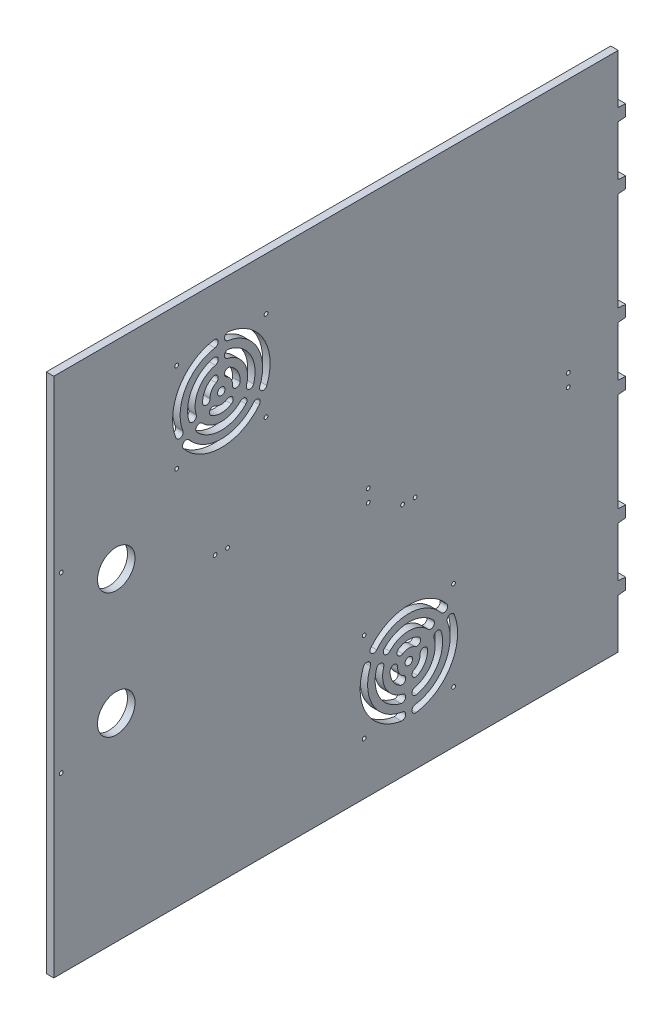
from build123d import *
from OCP.BRepFilletAPI import BRepFilletAPI_MakeChamfer

# Parameters (mm, degrees)
BOSS_EXTRUDE1_DEPTH      = 6
SKETCH4_W                = 6
SKETCH4_H                = 10
BOSS_EXTRUDE2_DEPTH      = 6
CUT_EXTRUDE3_DEPTH       = 312.784173588
SKETCH10_W               = 10
SKETCH10_H               = 6
BOSS_EXTRUDE4_DEPTH      = 6
FILLET2_R                = 10
MIRROR1_COPY_1_DEPTH     = 312.784173588
MIRROR1_COPY_2_SKETCH_W  = 10
MIRROR1_COPY_2_SKETCH_H  = 6
MIRROR1_COPY_2_DEPTH     = 6
FILLET2_OF_MIRROR1_R     = 10
CHAMFER1_SIZE            = 6
CHAMFER1_SIZE_2          = 0.5
CHAMFER2_SIZE            = 0.5
CHAMFER2_SIZE_2          = 6
SKETCH13_R               = 1.5
CUT_EXTRUDE4_DEPTH       = 316.827121856
DELETEFACE1_START        = -1
DELETEFACE1_DEPTH        = 8
SKETCH12_W               = 451.56
SKETCH12_H               = 416.9
SKETCH12_R               = 1.5
BOSS_EXTRUDE6_DEPTH      = 6
SKETCH14_R               = 15
CUT_EXTRUDE5_DEPTH       = 312.784173588
SKETCH15_R               = 1.5
SKETCH15_R_2             = 3
CUT_EXTRUDE6_DEPTH       = 312.784173588
CIRPATTERN2_START        = -1
CIRPATTERN2_DEPTH        = 8
SKETCH16_R               = 1.5
CUT_EXTRUDE7_DEPTH       = 312.784173588
MOVE_FACE1_OUTLINE_R     = 1.5
MOVE_FACE1_OUTLINE_R_2   = 3
MOVE_FACE1_DEPTH         = 6
MOVE_FACE1_2_OUTLINE_R   = 1.5
MOVE_FACE1_2_OUTLINE_R_2 = 3
MOVE_FACE1_2_DEPTH       = 6


with BuildPart() as part:
    # Sketch1 → Boss-Extrude1 (new body)
    with BuildSketch(Plane(origin=(0, 0, 0), x_dir=(0, 0, -1), z_dir=(1, 0, 0))):
        Polygon((0, 208.45), (-225.78, 208.45), (-225.78, 140.466666667), (-219.78, 140.466666667), (-219.78, 141.866666667), (-217.58, 141.866666667), (-217.58, 140.466666667), (-214.78, 140.466666667), (-214.78, 137.466666667), (-217.58, 137.466666667), (-217.58, 136.066666667), (-219.78, 136.066666667), (-219.78, 137.466666667), (-225.78, 137.466666667), (-225.78, 1.5), (-219.78, 1.5), (-219.78, 2.9), (-217.58, 2.9), (-217.58, 1.5), (-214.78, 1.5), (-214.78, -1.5), (-217.58, -1.5), (-217.58, -2.9), (-219.78, -2.9), (-219.78, -1.5), (-225.78, -1.5), (-225.78, -137.466666667), (-219.78, -137.466666667), (-219.78, -136.066666667), (-217.58, -136.066666667), (-217.58, -137.466666667), (-214.78, -137.466666667), (-214.78, -140.466666667), (-217.58, -140.466666667), (-217.58, -141.866666667), (-219.78, -141.866666667), (-219.78, -140.466666667), (-225.78, -140.466666667), (-225.78, -208.45), (0, -208.45), align=None)
    boss_extrude1 = extrude(amount=BOSS_EXTRUDE1_DEPTH)

    # Sketch4 → Boss-Extrude2 (add)
    with BuildSketch(Plane(origin=(6, 0, 0), x_dir=(0, 0, -1), z_dir=(1, 0, 0))):
        with Locations((-228.78, 163.966666667)):
            Rectangle(SKETCH4_W, SKETCH4_H)
        with Locations((-228.78, 113.966666667)):
            Rectangle(SKETCH4_W, SKETCH4_H)
        with Locations((-228.78, 25)):
            Rectangle(SKETCH4_W, SKETCH4_H)
        with Locations((-228.78, -25)):
            Rectangle(SKETCH4_W, SKETCH4_H)
        with Locations((-228.78, -113.966666667)):
            Rectangle(SKETCH4_W, SKETCH4_H)
        with Locations((-228.78, -163.966666667)):
            Rectangle(SKETCH4_W, SKETCH4_H)
    boss_extrude2 = extrude(amount=-BOSS_EXTRUDE2_DEPTH)

    # Sketch9 → Cut-Extrude3 (cut, through all)
    with BuildSketch(Plane(origin=(6, 0, 0), x_dir=(0, 0, -1), z_dir=(1, 0, 0))):
        Polygon((-152.02, 208.45), (-152.02, 202.45), (-153.42, 202.45), (-153.42, 200.25), (-152.02, 200.25), (-152.02, 197.45), (-149.02, 197.45), (-149.02, 200.25), (-147.62, 200.25), (-147.62, 202.45), (-149.02, 202.45), (-149.02, 208.45), align=None)
        Polygon((-1.5, 208.45), (-1.5, 202.45), (-2.9, 202.45), (-2.9, 200.25), (-1.5, 200.25), (-1.5, 197.45), (1.5, 197.45), (1.5, 200.25), (2.9, 200.25), (2.9, 202.45), (1.5, 202.45), (1.5, 208.45), align=None)
    cut_extrude3 = extrude(amount=-CUT_EXTRUDE3_DEPTH, mode=Mode.SUBTRACT)

    # Sketch10 → Boss-Extrude4 (add)
    with BuildSketch(Plane(origin=(6, 0, 0), x_dir=(0, 0, -1), z_dir=(1, 0, 0))):
        with Locations((-175.52, 211.45)):
            Rectangle(SKETCH10_W, SKETCH10_H)
        with Locations((-125.52, 211.45)):
            Rectangle(SKETCH10_W, SKETCH10_H)
        with Locations((-25, 211.45)):
            Rectangle(SKETCH10_W, SKETCH10_H)
    boss_extrude4 = extrude(amount=-BOSS_EXTRUDE4_DEPTH)

    # Mirror2: Cut-Extrude3, Boss-Extrude4 across plane
    add(cut_extrude3.mirror(Plane.ZX), mode=Mode.SUBTRACT)
    add(boss_extrude4.mirror(Plane.ZX))

    # Fillet2
    fillet2_edges = [part.edges().sort_by_distance(p)[0] for p in [
        (3, 208.45, 225.78),
        (3, -208.45, 225.78),
    ]]
    fillet(fillet2_edges, radius=FILLET2_R)

    # Mirror1: Boss-Extrude1, Boss-Extrude2, Cut-Extrude3, Boss-Extrude4 across plane
    add(boss_extrude1.mirror(Plane(origin=(6, -208.45, 0), x_dir=(1, 0, 0), z_dir=(0, 0, 1))))
    add(boss_extrude2.mirror(Plane(origin=(6, -208.45, 0), x_dir=(1, 0, 0), z_dir=(0, 0, 1))))
    add(cut_extrude3.mirror(Plane(origin=(6, -208.45, 0), x_dir=(1, 0, 0), z_dir=(0, 0, 1))), mode=Mode.SUBTRACT)
    add(boss_extrude4.mirror(Plane(origin=(6, -208.45, 0), x_dir=(1, 0, 0), z_dir=(0, 0, 1))))

    # Mirror1 copy 1 sketch → Mirror1 copy 1 (cut, through all)
    with BuildSketch(Plane(origin=(6, 0, 0), x_dir=(0, 0, 1), z_dir=(1, 0, 0))):
        Polygon((-152.02, 208.45), (-152.02, 202.45), (-153.42, 202.45), (-153.42, 200.25), (-152.02, 200.25), (-152.02, 197.45), (-149.02, 197.45), (-149.02, 200.25), (-147.62, 200.25), (-147.62, 202.45), (-149.02, 202.45), (-149.02, 208.45), align=None)
        Polygon((-1.5, 208.45), (-1.5, 202.45), (-2.9, 202.45), (-2.9, 200.25), (-1.5, 200.25), (-1.5, 197.45), (1.5, 197.45), (1.5, 200.25), (2.9, 200.25), (2.9, 202.45), (1.5, 202.45), (1.5, 208.45), align=None)
    extrude(amount=-MIRROR1_COPY_1_DEPTH, mode=Mode.SUBTRACT)

    # Mirror1 copy 2 sketch → Mirror1 copy 2 (add)
    with BuildSketch(Plane(origin=(6, 0, 0), x_dir=(0, 0, 1), z_dir=(1, 0, 0))):
        with Locations((-175.52, 211.45)):
            Rectangle(MIRROR1_COPY_2_SKETCH_W, MIRROR1_COPY_2_SKETCH_H)
        with Locations((-125.52, 211.45)):
            Rectangle(MIRROR1_COPY_2_SKETCH_W, MIRROR1_COPY_2_SKETCH_H)
        with Locations((-25, 211.45)):
            Rectangle(MIRROR1_COPY_2_SKETCH_W, MIRROR1_COPY_2_SKETCH_H)
    extrude(amount=-MIRROR1_COPY_2_DEPTH)

    # Fillet2 of Mirror1
    fillet2_of_mirror1_edges = [part.edges().sort_by_distance(p)[0] for p in [
        (3, 208.45, -225.78),
        (3, -208.45, -225.78),
    ]]
    fillet(fillet2_of_mirror1_edges, radius=FILLET2_OF_MIRROR1_R)

    # Chamfer1
    chamfer1_edges_1 = [part.edges().sort_by_distance(p)[0] for p in [
        (3, 168.966666667, 231.78),
    ]]
    chamfer1_side_1 = [part.faces().sort_by_distance(p)[0] for p in [
        (3, 168.966666667, 231.77),
    ]]
    chamfer1_edges_2 = [part.edges().sort_by_distance(p)[0] for p in [
        (3, -158.966666667, 231.78),
    ]]
    chamfer1_side_2 = [part.faces().sort_by_distance(p)[0] for p in [
        (3, -158.966666667, 231.77),
    ]]
    chamfer1_edges_3 = [part.edges().sort_by_distance(p)[0] for p in [
        (3, -108.966666667, 231.78),
    ]]
    chamfer1_side_3 = [part.faces().sort_by_distance(p)[0] for p in [
        (3, -108.966666667, 231.77),
    ]]
    chamfer1_edges_4 = [part.edges().sort_by_distance(p)[0] for p in [
        (3, -20, 231.78),
    ]]
    chamfer1_side_4 = [part.faces().sort_by_distance(p)[0] for p in [
        (3, -20, 231.77),
    ]]
    chamfer1_edges_5 = [part.edges().sort_by_distance(p)[0] for p in [
        (3, 30, 231.78),
    ]]
    chamfer1_side_5 = [part.faces().sort_by_distance(p)[0] for p in [
        (3, 30, 231.77),
    ]]
    chamfer1_edges_6 = [part.edges().sort_by_distance(p)[0] for p in [
        (3, 118.966666667, 231.78),
    ]]
    chamfer1_side_6 = [part.faces().sort_by_distance(p)[0] for p in [
        (3, 118.966666667, 231.77),
    ]]
    chamfer1_edges_7 = [part.edges().sort_by_distance(p)[0] for p in [
        (3, -168.966666667, -231.78),
    ]]
    chamfer1_side_7 = [part.faces().sort_by_distance(p)[0] for p in [
        (3, -168.956666667, -231.78),
    ]]
    chamfer1_edges_8 = [part.edges().sort_by_distance(p)[0] for p in [
        (3, -118.966666667, -231.78),
    ]]
    chamfer1_side_8 = [part.faces().sort_by_distance(p)[0] for p in [
        (3, -118.956666667, -231.78),
    ]]
    chamfer1_edges_9 = [part.edges().sort_by_distance(p)[0] for p in [
        (3, -30, -231.78),
    ]]
    chamfer1_side_9 = [part.faces().sort_by_distance(p)[0] for p in [
        (3, -29.99, -231.78),
    ]]
    chamfer1_edges_10 = [part.edges().sort_by_distance(p)[0] for p in [
        (3, 20, -231.78),
    ]]
    chamfer1_side_10 = [part.faces().sort_by_distance(p)[0] for p in [
        (3, 20.01, -231.78),
    ]]
    chamfer1_edges_11 = [part.edges().sort_by_distance(p)[0] for p in [
        (3, 158.966666667, -231.78),
    ]]
    chamfer1_side_11 = [part.faces().sort_by_distance(p)[0] for p in [
        (3, 158.976666667, -231.78),
    ]]
    chamfer1_edges_12 = [part.edges().sort_by_distance(p)[0] for p in [
        (3, 108.966666667, -231.78),
    ]]
    chamfer1_side_12 = [part.faces().sort_by_distance(p)[0] for p in [
        (3, 108.976666667, -231.78),
    ]]
    chamfer1_edges_13 = [part.edges().sort_by_distance(p)[0] for p in [
        (3, -214.45, 180.52),
    ]]
    chamfer1_side_13 = [part.faces().sort_by_distance(p)[0] for p in [
        (3, -214.45, 180.51),
    ]]
    chamfer1_edges_14 = [part.edges().sort_by_distance(p)[0] for p in [
        (3, -214.45, 130.52),
    ]]
    chamfer1_side_14 = [part.faces().sort_by_distance(p)[0] for p in [
        (3, -214.45, 130.51),
    ]]
    chamfer1_edges_15 = [part.edges().sort_by_distance(p)[0] for p in [
        (3, -214.45, 30),
    ]]
    chamfer1_side_15 = [part.faces().sort_by_distance(p)[0] for p in [
        (3, -214.45, 29.99),
    ]]
    chamfer1_edges_16 = [part.edges().sort_by_distance(p)[0] for p in [
        (3, -214.45, -20),
    ]]
    chamfer1_side_16 = [part.faces().sort_by_distance(p)[0] for p in [
        (3, -214.45, -20.01),
    ]]
    chamfer1_edges_17 = [part.edges().sort_by_distance(p)[0] for p in [
        (3, -214.45, -120.52),
    ]]
    chamfer1_side_17 = [part.faces().sort_by_distance(p)[0] for p in [
        (3, -214.45, -120.53),
    ]]
    chamfer1_edges_18 = [part.edges().sort_by_distance(p)[0] for p in [
        (3, -214.45, -170.52),
    ]]
    chamfer1_side_18 = [part.faces().sort_by_distance(p)[0] for p in [
        (3, -214.45, -170.53),
    ]]
    chamfer1_edges_19 = [part.edges().sort_by_distance(p)[0] for p in [
        (3, 214.45, -180.52),
    ]]
    chamfer1_side_19 = [part.faces().sort_by_distance(p)[0] for p in [
        (3, 214.44, -180.52),
    ]]
    chamfer1_edges_20 = [part.edges().sort_by_distance(p)[0] for p in [
        (3, 214.45, -130.52),
    ]]
    chamfer1_side_20 = [part.faces().sort_by_distance(p)[0] for p in [
        (3, 214.44, -130.52),
    ]]
    chamfer1_edges_21 = [part.edges().sort_by_distance(p)[0] for p in [
        (3, 214.45, -30),
    ]]
    chamfer1_side_21 = [part.faces().sort_by_distance(p)[0] for p in [
        (3, 214.44, -30),
    ]]
    chamfer1_edges_22 = [part.edges().sort_by_distance(p)[0] for p in [
        (3, 214.45, 20),
    ]]
    chamfer1_side_22 = [part.faces().sort_by_distance(p)[0] for p in [
        (3, 214.44, 20),
    ]]
    chamfer1_edges_23 = [part.edges().sort_by_distance(p)[0] for p in [
        (3, 214.45, 120.52),
    ]]
    chamfer1_side_23 = [part.faces().sort_by_distance(p)[0] for p in [
        (3, 214.44, 120.52),
    ]]
    chamfer1_edges_24 = [part.edges().sort_by_distance(p)[0] for p in [
        (3, 214.45, 170.52),
    ]]
    chamfer1_side_24 = [part.faces().sort_by_distance(p)[0] for p in [
        (3, 214.44, 170.52),
    ]]
    chamfer1 = BRepFilletAPI_MakeChamfer(part.part.solid().wrapped)
    for e in chamfer1_edges_1:
        chamfer1.Add(CHAMFER1_SIZE - 0.0001, CHAMFER1_SIZE_2 - 0.0001, e.wrapped, chamfer1_side_1[0].wrapped)
    for e in chamfer1_edges_2:
        chamfer1.Add(CHAMFER1_SIZE - 0.0001, CHAMFER1_SIZE_2 - 0.0001, e.wrapped, chamfer1_side_2[0].wrapped)
    for e in chamfer1_edges_3:
        chamfer1.Add(CHAMFER1_SIZE - 0.0001, CHAMFER1_SIZE_2 - 0.0001, e.wrapped, chamfer1_side_3[0].wrapped)
    for e in chamfer1_edges_4:
        chamfer1.Add(CHAMFER1_SIZE - 0.0001, CHAMFER1_SIZE_2 - 0.0001, e.wrapped, chamfer1_side_4[0].wrapped)
    for e in chamfer1_edges_5:
        chamfer1.Add(CHAMFER1_SIZE - 0.0001, CHAMFER1_SIZE_2 - 0.0001, e.wrapped, chamfer1_side_5[0].wrapped)
    for e in chamfer1_edges_6:
        chamfer1.Add(CHAMFER1_SIZE - 0.0001, CHAMFER1_SIZE_2 - 0.0001, e.wrapped, chamfer1_side_6[0].wrapped)
    for e in chamfer1_edges_7:
        chamfer1.Add(CHAMFER1_SIZE_2 - 0.0001, CHAMFER1_SIZE - 0.0001, e.wrapped, chamfer1_side_7[0].wrapped)
    for e in chamfer1_edges_8:
        chamfer1.Add(CHAMFER1_SIZE_2 - 0.0001, CHAMFER1_SIZE - 0.0001, e.wrapped, chamfer1_side_8[0].wrapped)
    for e in chamfer1_edges_9:
        chamfer1.Add(CHAMFER1_SIZE_2 - 0.0001, CHAMFER1_SIZE - 0.0001, e.wrapped, chamfer1_side_9[0].wrapped)
    for e in chamfer1_edges_10:
        chamfer1.Add(CHAMFER1_SIZE_2 - 0.0001, CHAMFER1_SIZE - 0.0001, e.wrapped, chamfer1_side_10[0].wrapped)
    for e in chamfer1_edges_11:
        chamfer1.Add(CHAMFER1_SIZE_2 - 0.0001, CHAMFER1_SIZE - 0.0001, e.wrapped, chamfer1_side_11[0].wrapped)
    for e in chamfer1_edges_12:
        chamfer1.Add(CHAMFER1_SIZE_2 - 0.0001, CHAMFER1_SIZE - 0.0001, e.wrapped, chamfer1_side_12[0].wrapped)
    for e in chamfer1_edges_13:
        chamfer1.Add(CHAMFER1_SIZE_2 - 0.0001, CHAMFER1_SIZE - 0.0001, e.wrapped, chamfer1_side_13[0].wrapped)
    for e in chamfer1_edges_14:
        chamfer1.Add(CHAMFER1_SIZE_2 - 0.0001, CHAMFER1_SIZE - 0.0001, e.wrapped, chamfer1_side_14[0].wrapped)
    for e in chamfer1_edges_15:
        chamfer1.Add(CHAMFER1_SIZE_2 - 0.0001, CHAMFER1_SIZE - 0.0001, e.wrapped, chamfer1_side_15[0].wrapped)
    for e in chamfer1_edges_16:
        chamfer1.Add(CHAMFER1_SIZE_2 - 0.0001, CHAMFER1_SIZE - 0.0001, e.wrapped, chamfer1_side_16[0].wrapped)
    for e in chamfer1_edges_17:
        chamfer1.Add(CHAMFER1_SIZE_2 - 0.0001, CHAMFER1_SIZE - 0.0001, e.wrapped, chamfer1_side_17[0].wrapped)
    for e in chamfer1_edges_18:
        chamfer1.Add(CHAMFER1_SIZE_2 - 0.0001, CHAMFER1_SIZE - 0.0001, e.wrapped, chamfer1_side_18[0].wrapped)
    for e in chamfer1_edges_19:
        chamfer1.Add(CHAMFER1_SIZE - 0.0001, CHAMFER1_SIZE_2 - 0.0001, e.wrapped, chamfer1_side_19[0].wrapped)
    for e in chamfer1_edges_20:
        chamfer1.Add(CHAMFER1_SIZE - 0.0001, CHAMFER1_SIZE_2 - 0.0001, e.wrapped, chamfer1_side_20[0].wrapped)
    for e in chamfer1_edges_21:
        chamfer1.Add(CHAMFER1_SIZE - 0.0001, CHAMFER1_SIZE_2 - 0.0001, e.wrapped, chamfer1_side_21[0].wrapped)
    for e in chamfer1_edges_22:
        chamfer1.Add(CHAMFER1_SIZE - 0.0001, CHAMFER1_SIZE_2 - 0.0001, e.wrapped, chamfer1_side_22[0].wrapped)
    for e in chamfer1_edges_23:
        chamfer1.Add(CHAMFER1_SIZE - 0.0001, CHAMFER1_SIZE_2 - 0.0001, e.wrapped, chamfer1_side_23[0].wrapped)
    for e in chamfer1_edges_24:
        chamfer1.Add(CHAMFER1_SIZE - 0.0001, CHAMFER1_SIZE_2 - 0.0001, e.wrapped, chamfer1_side_24[0].wrapped)
    add(Compound.cast(chamfer1.Shape()), mode=Mode.REPLACE)  # a hair under: the kernel refuses the full size

    # Chamfer2
    chamfer2_edges_1 = [part.edges().sort_by_distance(p)[0] for p in [
        (3, 158.966666667, 231.78),
    ]]
    chamfer2_side_1 = [part.faces().sort_by_distance(p)[0] for p in [
        (3, 158.976666667, 231.78),
    ]]
    chamfer2_edges_2 = [part.edges().sort_by_distance(p)[0] for p in [
        (3, -118.966666667, 231.78),
    ]]
    chamfer2_side_2 = [part.faces().sort_by_distance(p)[0] for p in [
        (3, -118.956666667, 231.78),
    ]]
    chamfer2_edges_3 = [part.edges().sort_by_distance(p)[0] for p in [
        (3, -168.966666667, 231.78),
    ]]
    chamfer2_side_3 = [part.faces().sort_by_distance(p)[0] for p in [
        (3, -168.956666667, 231.78),
    ]]
    chamfer2_edges_4 = [part.edges().sort_by_distance(p)[0] for p in [
        (3, 20, 231.78),
    ]]
    chamfer2_side_4 = [part.faces().sort_by_distance(p)[0] for p in [
        (3, 20.01, 231.78),
    ]]
    chamfer2_edges_5 = [part.edges().sort_by_distance(p)[0] for p in [
        (3, -30, 231.78),
    ]]
    chamfer2_side_5 = [part.faces().sort_by_distance(p)[0] for p in [
        (3, -29.99, 231.78),
    ]]
    chamfer2_edges_6 = [part.edges().sort_by_distance(p)[0] for p in [
        (3, 108.966666667, 231.78),
    ]]
    chamfer2_side_6 = [part.faces().sort_by_distance(p)[0] for p in [
        (3, 108.976666667, 231.78),
    ]]
    chamfer2_edges_7 = [part.edges().sort_by_distance(p)[0] for p in [
        (3, 118.966666667, -231.78),
    ]]
    chamfer2_side_7 = [part.faces().sort_by_distance(p)[0] for p in [
        (3, 118.966666667, -231.77),
    ]]
    chamfer2_edges_8 = [part.edges().sort_by_distance(p)[0] for p in [
        (3, 168.966666667, -231.78),
    ]]
    chamfer2_side_8 = [part.faces().sort_by_distance(p)[0] for p in [
        (3, 168.966666667, -231.77),
    ]]
    chamfer2_edges_9 = [part.edges().sort_by_distance(p)[0] for p in [
        (3, -20, -231.78),
    ]]
    chamfer2_side_9 = [part.faces().sort_by_distance(p)[0] for p in [
        (3, -20, -231.77),
    ]]
    chamfer2_edges_10 = [part.edges().sort_by_distance(p)[0] for p in [
        (3, 30, -231.78),
    ]]
    chamfer2_side_10 = [part.faces().sort_by_distance(p)[0] for p in [
        (3, 30, -231.77),
    ]]
    chamfer2_edges_11 = [part.edges().sort_by_distance(p)[0] for p in [
        (3, -108.966666667, -231.78),
    ]]
    chamfer2_side_11 = [part.faces().sort_by_distance(p)[0] for p in [
        (3, -108.966666667, -231.77),
    ]]
    chamfer2_edges_12 = [part.edges().sort_by_distance(p)[0] for p in [
        (3, -158.966666667, -231.78),
    ]]
    chamfer2_side_12 = [part.faces().sort_by_distance(p)[0] for p in [
        (3, -158.966666667, -231.77),
    ]]
    chamfer2_edges_13 = [part.edges().sort_by_distance(p)[0] for p in [
        (3, 214.45, 180.52),
    ]]
    chamfer2_side_13 = [part.faces().sort_by_distance(p)[0] for p in [
        (3, 214.45, 180.51),
    ]]
    chamfer2_edges_14 = [part.edges().sort_by_distance(p)[0] for p in [
        (3, 214.45, 130.52),
    ]]
    chamfer2_side_14 = [part.faces().sort_by_distance(p)[0] for p in [
        (3, 214.45, 130.51),
    ]]
    chamfer2_edges_15 = [part.edges().sort_by_distance(p)[0] for p in [
        (3, 214.45, 30),
    ]]
    chamfer2_side_15 = [part.faces().sort_by_distance(p)[0] for p in [
        (3, 214.45, 29.99),
    ]]
    chamfer2_edges_16 = [part.edges().sort_by_distance(p)[0] for p in [
        (3, 214.45, -20),
    ]]
    chamfer2_side_16 = [part.faces().sort_by_distance(p)[0] for p in [
        (3, 214.45, -20.01),
    ]]
    chamfer2_edges_17 = [part.edges().sort_by_distance(p)[0] for p in [
        (3, 214.45, -120.52),
    ]]
    chamfer2_side_17 = [part.faces().sort_by_distance(p)[0] for p in [
        (3, 214.45, -120.53),
    ]]
    chamfer2_edges_18 = [part.edges().sort_by_distance(p)[0] for p in [
        (3, 214.45, -170.52),
    ]]
    chamfer2_side_18 = [part.faces().sort_by_distance(p)[0] for p in [
        (3, 214.45, -170.53),
    ]]
    chamfer2_edges_19 = [part.edges().sort_by_distance(p)[0] for p in [
        (3, -214.45, -180.52),
    ]]
    chamfer2_side_19 = [part.faces().sort_by_distance(p)[0] for p in [
        (3, -214.44, -180.52),
    ]]
    chamfer2_edges_20 = [part.edges().sort_by_distance(p)[0] for p in [
        (3, -214.45, -130.52),
    ]]
    chamfer2_side_20 = [part.faces().sort_by_distance(p)[0] for p in [
        (3, -214.44, -130.52),
    ]]
    chamfer2_edges_21 = [part.edges().sort_by_distance(p)[0] for p in [
        (3, -214.45, -30),
    ]]
    chamfer2_side_21 = [part.faces().sort_by_distance(p)[0] for p in [
        (3, -214.44, -30),
    ]]
    chamfer2_edges_22 = [part.edges().sort_by_distance(p)[0] for p in [
        (3, -214.45, 20),
    ]]
    chamfer2_side_22 = [part.faces().sort_by_distance(p)[0] for p in [
        (3, -214.44, 20),
    ]]
    chamfer2_edges_23 = [part.edges().sort_by_distance(p)[0] for p in [
        (3, -214.45, 120.52),
    ]]
    chamfer2_side_23 = [part.faces().sort_by_distance(p)[0] for p in [
        (3, -214.44, 120.52),
    ]]
    chamfer2_edges_24 = [part.edges().sort_by_distance(p)[0] for p in [
        (3, -214.45, 170.52),
    ]]
    chamfer2_side_24 = [part.faces().sort_by_distance(p)[0] for p in [
        (3, -214.44, 170.52),
    ]]
    chamfer2 = BRepFilletAPI_MakeChamfer(part.part.solid().wrapped)
    for e in chamfer2_edges_1:
        chamfer2.Add(CHAMFER2_SIZE - 0.0001, CHAMFER2_SIZE_2 - 0.0001, e.wrapped, chamfer2_side_1[0].wrapped)
    for e in chamfer2_edges_2:
        chamfer2.Add(CHAMFER2_SIZE - 0.0001, CHAMFER2_SIZE_2 - 0.0001, e.wrapped, chamfer2_side_2[0].wrapped)
    for e in chamfer2_edges_3:
        chamfer2.Add(CHAMFER2_SIZE - 0.0001, CHAMFER2_SIZE_2 - 0.0001, e.wrapped, chamfer2_side_3[0].wrapped)
    for e in chamfer2_edges_4:
        chamfer2.Add(CHAMFER2_SIZE - 0.0001, CHAMFER2_SIZE_2 - 0.0001, e.wrapped, chamfer2_side_4[0].wrapped)
    for e in chamfer2_edges_5:
        chamfer2.Add(CHAMFER2_SIZE - 0.0001, CHAMFER2_SIZE_2 - 0.0001, e.wrapped, chamfer2_side_5[0].wrapped)
    for e in chamfer2_edges_6:
        chamfer2.Add(CHAMFER2_SIZE - 0.0001, CHAMFER2_SIZE_2 - 0.0001, e.wrapped, chamfer2_side_6[0].wrapped)
    for e in chamfer2_edges_7:
        chamfer2.Add(CHAMFER2_SIZE_2 - 0.0001, CHAMFER2_SIZE - 0.0001, e.wrapped, chamfer2_side_7[0].wrapped)
    for e in chamfer2_edges_8:
        chamfer2.Add(CHAMFER2_SIZE_2 - 0.0001, CHAMFER2_SIZE - 0.0001, e.wrapped, chamfer2_side_8[0].wrapped)
    for e in chamfer2_edges_9:
        chamfer2.Add(CHAMFER2_SIZE_2 - 0.0001, CHAMFER2_SIZE - 0.0001, e.wrapped, chamfer2_side_9[0].wrapped)
    for e in chamfer2_edges_10:
        chamfer2.Add(CHAMFER2_SIZE_2 - 0.0001, CHAMFER2_SIZE - 0.0001, e.wrapped, chamfer2_side_10[0].wrapped)
    for e in chamfer2_edges_11:
        chamfer2.Add(CHAMFER2_SIZE_2 - 0.0001, CHAMFER2_SIZE - 0.0001, e.wrapped, chamfer2_side_11[0].wrapped)
    for e in chamfer2_edges_12:
        chamfer2.Add(CHAMFER2_SIZE_2 - 0.0001, CHAMFER2_SIZE - 0.0001, e.wrapped, chamfer2_side_12[0].wrapped)
    for e in chamfer2_edges_13:
        chamfer2.Add(CHAMFER2_SIZE - 0.0001, CHAMFER2_SIZE_2 - 0.0001, e.wrapped, chamfer2_side_13[0].wrapped)
    for e in chamfer2_edges_14:
        chamfer2.Add(CHAMFER2_SIZE - 0.0001, CHAMFER2_SIZE_2 - 0.0001, e.wrapped, chamfer2_side_14[0].wrapped)
    for e in chamfer2_edges_15:
        chamfer2.Add(CHAMFER2_SIZE - 0.0001, CHAMFER2_SIZE_2 - 0.0001, e.wrapped, chamfer2_side_15[0].wrapped)
    for e in chamfer2_edges_16:
        chamfer2.Add(CHAMFER2_SIZE - 0.0001, CHAMFER2_SIZE_2 - 0.0001, e.wrapped, chamfer2_side_16[0].wrapped)
    for e in chamfer2_edges_17:
        chamfer2.Add(CHAMFER2_SIZE - 0.0001, CHAMFER2_SIZE_2 - 0.0001, e.wrapped, chamfer2_side_17[0].wrapped)
    for e in chamfer2_edges_18:
        chamfer2.Add(CHAMFER2_SIZE - 0.0001, CHAMFER2_SIZE_2 - 0.0001, e.wrapped, chamfer2_side_18[0].wrapped)
    for e in chamfer2_edges_19:
        chamfer2.Add(CHAMFER2_SIZE_2 - 0.0001, CHAMFER2_SIZE - 0.0001, e.wrapped, chamfer2_side_19[0].wrapped)
    for e in chamfer2_edges_20:
        chamfer2.Add(CHAMFER2_SIZE_2 - 0.0001, CHAMFER2_SIZE - 0.0001, e.wrapped, chamfer2_side_20[0].wrapped)
    for e in chamfer2_edges_21:
        chamfer2.Add(CHAMFER2_SIZE_2 - 0.0001, CHAMFER2_SIZE - 0.0001, e.wrapped, chamfer2_side_21[0].wrapped)
    for e in chamfer2_edges_22:
        chamfer2.Add(CHAMFER2_SIZE_2 - 0.0001, CHAMFER2_SIZE - 0.0001, e.wrapped, chamfer2_side_22[0].wrapped)
    for e in chamfer2_edges_23:
        chamfer2.Add(CHAMFER2_SIZE_2 - 0.0001, CHAMFER2_SIZE - 0.0001, e.wrapped, chamfer2_side_23[0].wrapped)
    for e in chamfer2_edges_24:
        chamfer2.Add(CHAMFER2_SIZE_2 - 0.0001, CHAMFER2_SIZE - 0.0001, e.wrapped, chamfer2_side_24[0].wrapped)
    add(Compound.cast(chamfer2.Shape()), mode=Mode.REPLACE)  # a hair under: the kernel refuses the full size

    # Sketch13 → Cut-Extrude4 (cut, through all)
    with BuildSketch(Plane(origin=(6, 0, 0), x_dir=(0, 0, -1), z_dir=(1, 0, 0))):
        with Locations((-219.83, 69.483333333)):
            Circle(SKETCH13_R)
    cut_extrude4 = extrude(amount=-CUT_EXTRUDE4_DEPTH, mode=Mode.SUBTRACT)

    # DeleteFace1: read off the stored shape, not the designer's step
    # DeleteFace1 outline → DeleteFace1 (cut)
    with BuildSketch(Plane.YZ.offset(DELETEFACE1_START)):
        Polygon((-214.45, 171.02), (-208.45, 170.52), (-208.45, 180.52), (-214.45, 180.02), align=None)
        Polygon((-208.45, -180.52), (-208.45, -170.52), (-214.45, -171.02), (-214.45, -180.02), align=None)
        Polygon((208.45, -170.52), (208.45, -180.52), (214.45, -180.02), (214.45, -171.02), align=None)
        Polygon((214.45, 180.02), (208.45, 180.52), (208.45, 170.52), (214.45, 171.02), align=None)
        Polygon((168.966666667, 225.78), (168.466666667, 231.78), (159.466666667, 231.78), (158.966666667, 225.78), align=None)
        Polygon((118.966666667, 225.78), (118.466666667, 231.78), (109.466666667, 231.78), (108.966666667, 225.78), align=None)
        Polygon((20, 225.78), (30, 225.78), (29.5, 231.78), (20.5, 231.78), align=None)
        Polygon((-20, 225.78), (-20.5, 231.78), (-29.5, 231.78), (-30, 225.78), align=None)
        Polygon((-118.966666667, 225.78), (-108.966666667, 225.78), (-109.466666667, 231.78), (-118.466666667, 231.78), align=None)
        Polygon((-158.966666667, 225.78), (-159.466666667, 231.78), (-168.466666667, 231.78), (-168.966666667, 225.78), align=None)
        Polygon((208.45, 120.52), (214.45, 121.02), (214.45, 130.02), (208.45, 130.52), align=None)
        Polygon((214.45, 29.5), (208.45, 30), (208.45, 20), (214.45, 20.5), align=None)
        Polygon((208.45, -20), (208.45, -30), (214.45, -29.5), (214.45, -20.5), align=None)
        Polygon((214.45, -130.02), (214.45, -121.02), (208.45, -120.52), (208.45, -130.52), align=None)
        Polygon((-208.45, 20), (-208.45, 30), (-214.45, 29.5), (-214.45, 20.5), align=None)
        Polygon((-214.45, 130.02), (-214.45, 121.02), (-208.45, 120.52), (-208.45, 130.52), align=None)
        Polygon((-208.45, -120.52), (-214.45, -121.02), (-214.45, -130.02), (-208.45, -130.52), align=None)
        Polygon((-214.45, -29.5), (-208.45, -30), (-208.45, -20), (-214.45, -20.5), align=None)
    extrude(amount=DELETEFACE1_DEPTH, mode=Mode.SUBTRACT)

    # Sketch12 → Boss-Extrude6 (add)
    with BuildSketch(Plane(origin=(6, 0, 0), x_dir=(0, 0, -1), z_dir=(1, 0, 0))):
        Rectangle(SKETCH12_W, SKETCH12_H)
        with Locations((-219.83, 69.483333333)):
            Circle(SKETCH12_R, mode=Mode.SUBTRACT)
    extrude(amount=-BOSS_EXTRUDE6_DEPTH)

    # Mirror4: Cut-Extrude4 across plane
    add(cut_extrude4.mirror(Plane.ZX), mode=Mode.SUBTRACT)

    # Sketch14 → Cut-Extrude5 (cut, through all)
    with BuildSketch(Plane(origin=(6, 0, 0), x_dir=(0, 0, -1), z_dir=(1, 0, 0))):
        with Locations((-175.78, 50)):
            Circle(SKETCH14_R)
        with Locations((-175.78, -50)):
            Circle(SKETCH14_R)
    extrude(amount=-CUT_EXTRUDE5_DEPTH, mode=Mode.SUBTRACT)

    # Sketch15 → Cut-Extrude6 (cut, through all)
    with BuildSketch(Plane(origin=(6, 0, 0), x_dir=(0, 0, -1), z_dir=(1, 0, 0))):
        with Locations((22.53, -95.2)):
            Circle(SKETCH15_R)
        with Locations((94.03, -95.2)):
            Circle(SKETCH15_R)
        with Locations((94.03, -166.7)):
            Circle(SKETCH15_R)
        with Locations((22.53, -166.7)):
            Circle(SKETCH15_R)
        with Locations((58.28, -130.95)):
            Circle(SKETCH15_R_2)
        with BuildLine():
            ThreePointArc((21.922341787, -116.838986951), (24.505009252, -150.45), (52.321666667, -169.492162159))
            ThreePointArc((52.321666667, -169.492162159), (55.744781705, -166.985713788), (53.238333333, -163.56259875))
            ThreePointArc((53.238333333, -163.56259875), (29.701161675, -147.45), (27.515827666, -119.009912036))
            ThreePointArc((27.515827666, -119.009912036), (25.804547269, -115.127706554), (21.922341787, -116.838986951))
        make_face()
        with BuildLine():
            ThreePointArc((32.425842868, -123.167805001), (34.897314098, -144.45), (52.0925, -157.231454369))
            ThreePointArc((52.0925, -157.231454369), (55.700161597, -154.998792772), (53.4675, -151.391131176))
            ThreePointArc((53.4675, -151.391131176), (40.093466521, -141.45), (38.17121112, -124.897181668))
            ThreePointArc((38.17121112, -124.897181668), (36.163215327, -121.159809209), (32.425842868, -123.167805001))
        make_face()
        with BuildLine():
            ThreePointArc((43.296904249, -130.238071836), (45.289618943, -138.45), (51.405, -144.28170563))
            ThreePointArc((51.405, -144.28170563), (55.446341126, -142.990364504), (54.155, -138.949023378))
            ThreePointArc((54.155, -138.949023378), (50.485771366, -135.45), (49.290142549, -130.522843102))
            ThreePointArc((49.290142549, -130.522843102), (46.435909032, -127.383838319), (43.296904249, -130.238071836))
        make_face()
    cut_extrude6 = extrude(amount=-CUT_EXTRUDE6_DEPTH, mode=Mode.SUBTRACT)

    # CirPattern2: read off the stored shape, not the designer's step
    # CirPattern2 outline → CirPattern2 (cut)
    with BuildSketch(Plane.YZ.offset(CIRPATTERN2_START)):
        with BuildLine():
            ThreePointArc((-106.51885089, -88.67932488), (-91.95, -58.28), (-106.51885089, -27.88067512))
            ThreePointArc((-106.51885089, -27.88067512), (-110.736579658, -28.339765564), (-110.277489214, -32.557494332))
            ThreePointArc((-110.277489214, -32.557494332), (-97.95, -58.28), (-110.277489214, -84.002505668))
            ThreePointArc((-110.277489214, -84.002505668), (-110.736579658, -88.220234436), (-106.51885089, -88.67932488))
        make_face()
        with BuildLine():
            ThreePointArc((-119.009912036, -89.044172334), (-147.45, -86.858838325), (-163.56259875, -63.321666667))
            ThreePointArc((-163.56259875, -63.321666667), (-166.985713788, -60.815218295), (-169.492162159, -64.238333333))
            ThreePointArc((-169.492162159, -64.238333333), (-150.45, -92.054990748), (-116.838986951, -94.637658213))
            ThreePointArc((-116.838986951, -94.637658213), (-115.127706554, -90.755452731), (-119.009912036, -89.044172334))
        make_face()
        with BuildLine():
            ThreePointArc((-112.45074063, -77.946657132), (-103.95, -58.28), (-112.45074063, -38.613342868))
            ThreePointArc((-112.45074063, -38.613342868), (-116.691398019, -38.743053731), (-116.561687156, -42.98371112))
            ThreePointArc((-116.561687156, -42.98371112), (-109.95, -58.28), (-116.561687156, -73.57628888))
            ThreePointArc((-116.561687156, -73.57628888), (-116.691398019, -77.816946269), (-112.45074063, -77.946657132))
        make_face()
        with BuildLine():
            ThreePointArc((-124.897181668, -78.38878888), (-141.45, -76.466533479), (-151.391131176, -63.0925))
            ThreePointArc((-151.391131176, -63.0925), (-154.998792773, -60.859838403), (-157.231454369, -64.4675))
            ThreePointArc((-157.231454369, -64.4675), (-144.45, -81.662685902), (-123.167805001, -84.134157132))
            ThreePointArc((-123.167805001, -84.134157132), (-121.159809209, -80.396784673), (-124.897181668, -78.38878888))
        make_face()
        with BuildLine():
            ThreePointArc((-123.37813352, -53.415142549), (-121.95, -58.28), (-123.37813352, -63.144857451))
            ThreePointArc((-123.37813352, -63.144857451), (-122.475797177, -67.290432094), (-118.330222534, -66.388095751))
            ThreePointArc((-118.330222534, -66.388095751), (-115.95, -58.28), (-118.330222534, -50.171904249))
            ThreePointArc((-118.330222534, -50.171904249), (-122.475797177, -49.269567906), (-123.37813352, -53.415142549))
        make_face()
        with BuildLine():
            ThreePointArc((-130.522843102, -67.269857451), (-135.45, -66.074228634), (-138.949023378, -62.405))
            ThreePointArc((-138.949023378, -62.405), (-142.990364504, -61.113658874), (-144.28170563, -65.155))
            ThreePointArc((-144.28170563, -65.155), (-138.45, -71.270381057), (-130.238071836, -73.263095751))
            ThreePointArc((-130.238071836, -73.263095751), (-127.383838319, -70.124090968), (-130.522843102, -67.269857451))
        make_face()
    cirpattern2 = extrude(amount=CIRPATTERN2_DEPTH, mode=Mode.SUBTRACT)

    # Mirror11: Cut-Extrude6, CirPattern2 across plane
    add(cut_extrude6.mirror(Plane.ZX), mode=Mode.SUBTRACT)
    add(cirpattern2.mirror(Plane.ZX), mode=Mode.SUBTRACT)

    # Sketch16 → Cut-Extrude7 (cut, through all)
    with BuildSketch(Plane(origin=(6, 0, 0), x_dir=(0, 0, -1), z_dir=(1, 0, 0))):
        with Locations((53.28, -20)):
            Circle(SKETCH16_R)
        with Locations((63.28, -20)):
            Circle(SKETCH16_R)
        with Locations((25.78, -5)):
            Circle(SKETCH16_R)
        with Locations((185.78, -5)):
            Circle(SKETCH16_R)
    cut_extrude7 = extrude(amount=-CUT_EXTRUDE7_DEPTH, mode=Mode.SUBTRACT)

    # Mirror12: Cut-Extrude7 across plane
    add(cut_extrude7.mirror(Plane.ZX), mode=Mode.SUBTRACT)

    # Move Face1: read off the stored shape, not the designer's step
    # Move Face1 outline → Move Face1 (cut)
    with BuildSketch(Plane.YZ):
        with Locations((166.7, 127.47)):
            Circle(MOVE_FACE1_OUTLINE_R)
        with Locations((95.2, 127.47)):
            Circle(MOVE_FACE1_OUTLINE_R)
        with Locations((95.2, 55.97)):
            Circle(MOVE_FACE1_OUTLINE_R)
        with Locations((166.7, 55.97)):
            Circle(MOVE_FACE1_OUTLINE_R)
        with Locations((130.95, 91.72)):
            Circle(MOVE_FACE1_OUTLINE_R_2)
        with BuildLine():
            ThreePointArc((110.277489214, 65.997494332), (97.95, 91.72), (110.277489214, 117.442505668))
            ThreePointArc((110.277489214, 117.442505668), (110.736579658, 121.660234436), (106.51885089, 122.11932488))
            ThreePointArc((106.51885089, 122.11932488), (91.95, 91.72), (106.51885089, 61.32067512))
            ThreePointArc((106.51885089, 61.32067512), (110.736579658, 61.779765564), (110.277489214, 65.997494332))
        make_face()
        with BuildLine():
            ThreePointArc((163.56259875, 86.678333333), (147.45, 63.141161675), (119.009912036, 60.955827666))
            ThreePointArc((119.009912036, 60.955827666), (115.127706554, 59.244547269), (116.838986951, 55.362341787))
            ThreePointArc((116.838986951, 55.362341787), (150.45, 57.945009252), (169.492162159, 85.761666667))
            ThreePointArc((169.492162159, 85.761666667), (166.985713788, 89.184781705), (163.56259875, 86.678333333))
        make_face()
        with BuildLine():
            ThreePointArc((119.009912036, 122.484172334), (147.45, 120.298838325), (163.56259875, 96.761666667))
            ThreePointArc((163.56259875, 96.761666667), (166.985713788, 94.255218295), (169.492162159, 97.678333333))
            ThreePointArc((169.492162159, 97.678333333), (150.45, 125.494990748), (116.838986951, 128.077658213))
            ThreePointArc((116.838986951, 128.077658213), (115.127706554, 124.195452731), (119.009912036, 122.484172334))
        make_face()
        with BuildLine():
            ThreePointArc((116.561687156, 76.42371112), (109.95, 91.72), (116.561687156, 107.01628888))
            ThreePointArc((116.561687156, 107.01628888), (116.691398019, 111.256946269), (112.45074063, 111.386657132))
            ThreePointArc((112.45074063, 111.386657132), (103.95, 91.72), (112.45074063, 72.053342868))
            ThreePointArc((112.45074063, 72.053342868), (116.691398019, 72.183053731), (116.561687156, 76.42371112))
        make_face()
        with BuildLine():
            ThreePointArc((151.391131176, 86.9075), (141.45, 73.533466521), (124.897181668, 71.61121112))
            ThreePointArc((124.897181668, 71.61121112), (121.159809209, 69.603215327), (123.167805001, 65.865842868))
            ThreePointArc((123.167805001, 65.865842868), (144.45, 68.337314098), (157.231454369, 85.5325))
            ThreePointArc((157.231454369, 85.5325), (154.998792773, 89.140161597), (151.391131176, 86.9075))
        make_face()
        with BuildLine():
            ThreePointArc((124.897181668, 111.82878888), (141.45, 109.906533479), (151.391131176, 96.5325))
            ThreePointArc((151.391131176, 96.5325), (154.998792773, 94.299838403), (157.231454369, 97.9075))
            ThreePointArc((157.231454369, 97.9075), (144.45, 115.102685902), (123.167805001, 117.574157132))
            ThreePointArc((123.167805001, 117.574157132), (121.159809209, 113.836784673), (124.897181668, 111.82878888))
        make_face()
        with BuildLine():
            ThreePointArc((123.37813352, 86.855142549), (121.95, 91.72), (123.37813352, 96.584857451))
            ThreePointArc((123.37813352, 96.584857451), (122.475797177, 100.730432094), (118.330222534, 99.828095751))
            ThreePointArc((118.330222534, 99.828095751), (115.95, 91.72), (118.330222534, 83.611904249))
            ThreePointArc((118.330222534, 83.611904249), (122.475797177, 82.709567906), (123.37813352, 86.855142549))
        make_face()
        with BuildLine():
            ThreePointArc((138.949023378, 87.595), (135.45, 83.925771366), (130.522843102, 82.730142549))
            ThreePointArc((130.522843102, 82.730142549), (127.383838319, 79.875909032), (130.238071836, 76.736904249))
            ThreePointArc((130.238071836, 76.736904249), (138.45, 78.729618943), (144.28170563, 84.845))
            ThreePointArc((144.28170563, 84.845), (142.990364504, 88.886341126), (138.949023378, 87.595))
        make_face()
        with BuildLine():
            ThreePointArc((130.522843102, 100.709857451), (135.45, 99.514228634), (138.949023378, 95.845))
            ThreePointArc((138.949023378, 95.845), (142.990364504, 94.553658874), (144.28170563, 98.595))
            ThreePointArc((144.28170563, 98.595), (138.45, 104.710381057), (130.238071836, 106.703095751))
            ThreePointArc((130.238071836, 106.703095751), (127.383838319, 103.564090968), (130.522843102, 100.709857451))
        make_face()
        with Locations((20, 96.72)):
            Circle(MOVE_FACE1_OUTLINE_R)
        with Locations((20, 86.72)):
            Circle(MOVE_FACE1_OUTLINE_R)
    extrude(amount=MOVE_FACE1_DEPTH, mode=Mode.SUBTRACT)

    # Move Face1 2 outline → Move Face1 2 (add)
    with BuildSketch(Plane.YZ):
        with Locations((166.7, -22.53)):
            Circle(MOVE_FACE1_2_OUTLINE_R)
        with Locations((95.2, -22.53)):
            Circle(MOVE_FACE1_2_OUTLINE_R)
        with Locations((95.2, -94.03)):
            Circle(MOVE_FACE1_2_OUTLINE_R)
        with Locations((166.7, -94.03)):
            Circle(MOVE_FACE1_2_OUTLINE_R)
        with Locations((130.95, -58.28)):
            Circle(MOVE_FACE1_2_OUTLINE_R_2)
        with BuildLine():
            ThreePointArc((110.277489214, -84.002505668), (97.95, -58.28), (110.277489214, -32.557494332))
            ThreePointArc((110.277489214, -32.557494332), (110.736579658, -28.339765564), (106.51885089, -27.88067512))
            ThreePointArc((106.51885089, -27.88067512), (91.95, -58.28), (106.51885089, -88.67932488))
            ThreePointArc((106.51885089, -88.67932488), (110.736579658, -88.220234436), (110.277489214, -84.002505668))
        make_face()
        with BuildLine():
            ThreePointArc((163.56259875, -63.321666667), (147.45, -86.858838325), (119.009912036, -89.044172334))
            ThreePointArc((119.009912036, -89.044172334), (115.127706554, -90.755452731), (116.838986951, -94.637658213))
            ThreePointArc((116.838986951, -94.637658213), (150.45, -92.054990748), (169.492162159, -64.238333333))
            ThreePointArc((169.492162159, -64.238333333), (166.985713788, -60.815218295), (163.56259875, -63.321666667))
        make_face()
        with BuildLine():
            ThreePointArc((119.009912036, -27.515827666), (147.45, -29.701161675), (163.56259875, -53.238333333))
            ThreePointArc((163.56259875, -53.238333333), (166.985713788, -55.744781705), (169.492162159, -52.321666667))
            ThreePointArc((169.492162159, -52.321666667), (150.45, -24.505009252), (116.838986951, -21.922341787))
            ThreePointArc((116.838986951, -21.922341787), (115.127706554, -25.804547269), (119.009912036, -27.515827666))
        make_face()
        with BuildLine():
            ThreePointArc((116.561687156, -73.57628888), (109.95, -58.28), (116.561687156, -42.98371112))
            ThreePointArc((116.561687156, -42.98371112), (116.691398019, -38.743053731), (112.45074063, -38.613342868))
            ThreePointArc((112.45074063, -38.613342868), (103.95, -58.28), (112.45074063, -77.946657132))
            ThreePointArc((112.45074063, -77.946657132), (116.691398019, -77.816946269), (116.561687156, -73.57628888))
        make_face()
        with BuildLine():
            ThreePointArc((151.391131176, -63.0925), (141.45, -76.466533479), (124.897181668, -78.38878888))
            ThreePointArc((124.897181668, -78.38878888), (121.159809209, -80.396784673), (123.167805001, -84.134157132))
            ThreePointArc((123.167805001, -84.134157132), (144.45, -81.662685902), (157.231454369, -64.4675))
            ThreePointArc((157.231454369, -64.4675), (154.998792773, -60.859838403), (151.391131176, -63.0925))
        make_face()
        with BuildLine():
            ThreePointArc((124.897181668, -38.17121112), (141.45, -40.093466521), (151.391131176, -53.4675))
            ThreePointArc((151.391131176, -53.4675), (154.998792773, -55.700161597), (157.231454369, -52.0925))
            ThreePointArc((157.231454369, -52.0925), (144.45, -34.897314098), (123.167805001, -32.425842868))
            ThreePointArc((123.167805001, -32.425842868), (121.159809209, -36.163215327), (124.897181668, -38.17121112))
        make_face()
        with BuildLine():
            ThreePointArc((123.37813352, -63.144857451), (121.95, -58.28), (123.37813352, -53.415142549))
            ThreePointArc((123.37813352, -53.415142549), (122.475797177, -49.269567906), (118.330222534, -50.171904249))
            ThreePointArc((118.330222534, -50.171904249), (115.95, -58.28), (118.330222534, -66.388095751))
            ThreePointArc((118.330222534, -66.388095751), (122.475797177, -67.290432094), (123.37813352, -63.144857451))
        make_face()
        with BuildLine():
            ThreePointArc((138.949023378, -62.405), (135.45, -66.074228634), (130.522843102, -67.269857451))
            ThreePointArc((130.522843102, -67.269857451), (127.383838319, -70.124090968), (130.238071836, -73.263095751))
            ThreePointArc((130.238071836, -73.263095751), (138.45, -71.270381057), (144.28170563, -65.155))
            ThreePointArc((144.28170563, -65.155), (142.990364504, -61.113658874), (138.949023378, -62.405))
        make_face()
        with BuildLine():
            ThreePointArc((130.522843102, -49.290142549), (135.45, -50.485771366), (138.949023378, -54.155))
            ThreePointArc((138.949023378, -54.155), (142.990364504, -55.446341126), (144.28170563, -51.405))
            ThreePointArc((144.28170563, -51.405), (138.45, -45.289618943), (130.238071836, -43.296904249))
            ThreePointArc((130.238071836, -43.296904249), (127.383838319, -46.435909032), (130.522843102, -49.290142549))
        make_face()
        with Locations((20, -53.28)):
            Circle(MOVE_FACE1_2_OUTLINE_R)
        with Locations((20, -63.28)):
            Circle(MOVE_FACE1_2_OUTLINE_R)
    extrude(amount=MOVE_FACE1_2_DEPTH)


solid = part.part
